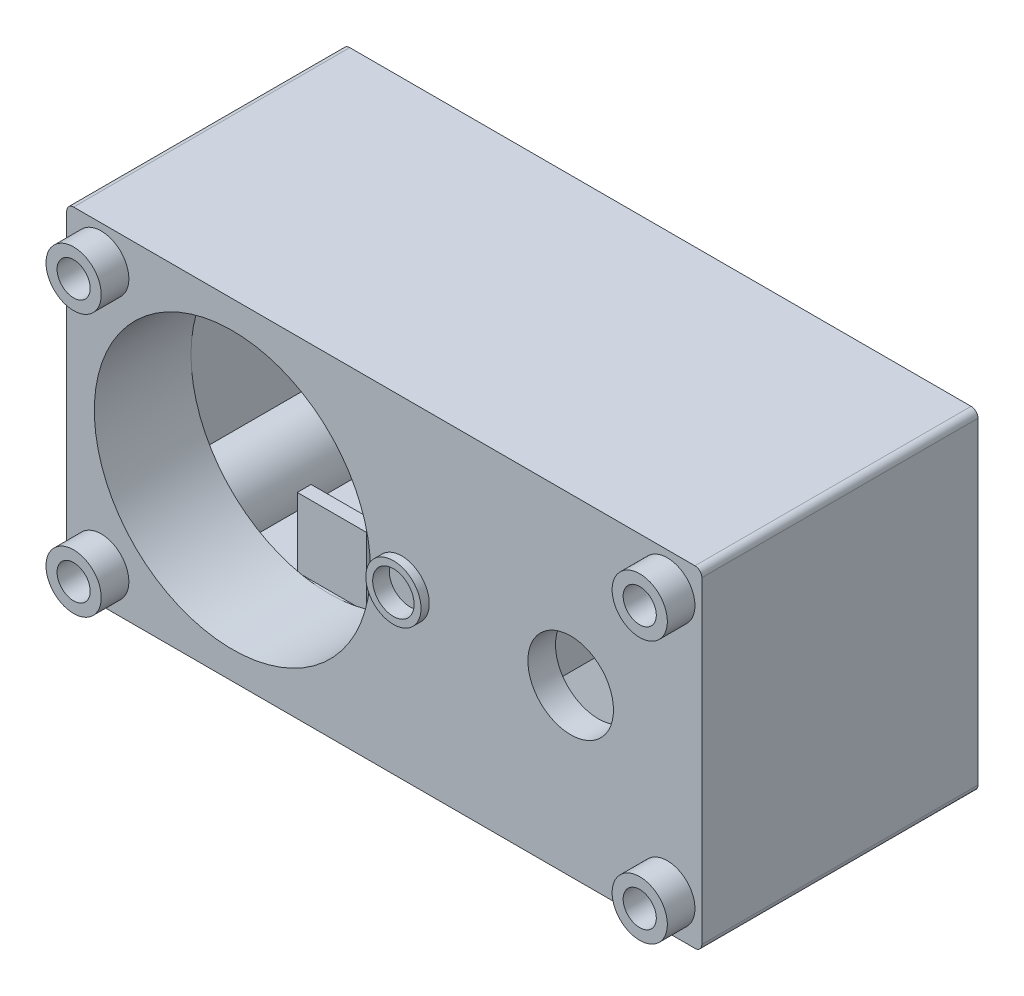
from build123d import *
from build123d.topology import SkipClean

# Parameters (mm, degrees)
SKETCH_1_W          = 23
SKETCH_1_H          = 12
SKETCH_1_R          = 0.6
EXTRUDE_1_DEPTH     = 10
SHELL_2_T           = -1
EXTRUDE_START       = 10
SKETCH_1_3_R        = 1
SKETCH_1_3_R_2      = 0.6
EXTRUDE_1_2_DEPTH   = 1
CUT_EXTRUDE_1_REACH = 18.378
SKETCH_2_R          = 5
SKETCH_2_R_2        = 1.55
SKETCH_2_3_R        = 1
SKETCH_2_3_R_2      = 0.75
EXTRUDE_2_DEPTH     = 0.3
CUT_EXTRUDE_START   = -0.3
SKETCH_2_4_R        = 0.75
CUT_EXTRUDE_2_DEPTH = 0.3
EXTRUDE_3_DEPTH     = 5
SKETCH_4_R          = 5.5
SKETCH_4_R_2        = 5
EXTRUDE_4_DEPTH     = 2.5
EXTRUDE_START_2     = -3.6
SKETCH_5_W          = 2.5
SKETCH_5_H          = 2.5
EXTRUDE_2_2_DEPTH   = 0.5
FILLET_1_R          = 0.25


with BuildPart() as part:
    # 草图1 → Extrude 1 (new body)
    with BuildSketch(Plane.XY):
        Rectangle(SKETCH_1_W, SKETCH_1_H)
        with Locations((-10.25, -4.75)):
            Circle(SKETCH_1_R, mode=Mode.SUBTRACT)
        with Locations((10.25, -4.75)):
            Circle(SKETCH_1_R, mode=Mode.SUBTRACT)
        with Locations((-10.25, 4.75)):
            Circle(SKETCH_1_R, mode=Mode.SUBTRACT)
        with Locations((10.25, 4.75)):
            Circle(SKETCH_1_R, mode=Mode.SUBTRACT)
    extrude(amount=EXTRUDE_1_DEPTH)

    # 抽壳2
    shell_2_openings = [part.faces().sort_by_distance(p)[0] for p in [
        (0, 0, 0),
    ]]
    offset(amount=SHELL_2_T, openings=shell_2_openings)

    # 草图1<3> → Extrude 1 2 (add)
    # profile 1 of 4: a face of its own
    with BuildSketch(Plane.XY.offset(EXTRUDE_START)):
        with Locations((-10.25, 4.75)):
            Circle(SKETCH_1_3_R)
        with Locations((-10.25, 4.75)):
            Circle(SKETCH_1_3_R_2, mode=Mode.SUBTRACT)
    # profile 2 of 4: a face of its own
    with BuildSketch(Plane.XY.offset(EXTRUDE_START)):
        with Locations((-10.25, -4.75)):
            Circle(SKETCH_1_3_R)
        with Locations((-10.25, -4.75)):
            Circle(SKETCH_1_3_R_2, mode=Mode.SUBTRACT)
    # profile 3 of 4: a face of its own
    with BuildSketch(Plane.XY.offset(EXTRUDE_START)):
        with Locations((10.25, -4.75)):
            Circle(SKETCH_1_3_R)
        with Locations((10.25, -4.75)):
            Circle(SKETCH_1_3_R_2, mode=Mode.SUBTRACT)
    # profile 4 of 4: a face of its own
    with BuildSketch(Plane.XY.offset(EXTRUDE_START)):
        with Locations((10.25, 4.75)):
            Circle(SKETCH_1_3_R)
        with Locations((10.25, 4.75)):
            Circle(SKETCH_1_3_R_2, mode=Mode.SUBTRACT)
    extrude(amount=EXTRUDE_1_2_DEPTH)

    # 草图2 → 切除-拉伸1 (cut, up to next)
    with BuildSketch(Plane.XY.offset(10), mode=Mode.PRIVATE) as cut_extrude_1_sk1:
        with Locations((-5.5, 0)):
            Circle(SKETCH_2_R)
    cut_extrude_1_tool1 = extrude(cut_extrude_1_sk1.sketch, amount=-CUT_EXTRUDE_1_REACH, mode=Mode.PRIVATE) & part.part
    # 草图2 → 切除-拉伸1 (cut, up to next)
    with BuildSketch(Plane.XY.offset(10), mode=Mode.PRIVATE) as cut_extrude_1_sk2:
        with Locations((6.75, 0)):
            Circle(SKETCH_2_R_2)
    cut_extrude_1_tool2 = extrude(cut_extrude_1_sk2.sketch, amount=-CUT_EXTRUDE_1_REACH, mode=Mode.PRIVATE) & part.part
    add(cut_extrude_1_tool1.solids().sort_by_distance((-5.5, 0, 10))[0], mode=Mode.SUBTRACT)
    add(cut_extrude_1_tool2.solids().sort_by_distance((6.75, 0, 10))[0], mode=Mode.SUBTRACT)

    # 草图2<3> → Extrude 2 (add)
    with BuildSketch(Plane.XY.offset(10)):
        with Locations((0.63, 0)):
            Circle(SKETCH_2_3_R)
        with Locations((0.63, 0)):
            Circle(SKETCH_2_3_R_2, mode=Mode.SUBTRACT)
    extrude(amount=EXTRUDE_2_DEPTH)

    # 草图2<4> → 切除-拉伸2 (cut)
    with BuildSketch(Plane.XY.offset(10).offset(CUT_EXTRUDE_START)):
        with Locations((0.63, 0)):
            Circle(SKETCH_2_4_R)
    extrude(amount=CUT_EXTRUDE_2_DEPTH, mode=Mode.SUBTRACT)

    # 草图3 → 拉伸-薄壁3 (add)
    with BuildSketch(Plane(origin=(0, 0, 9), x_dir=(-1, 0, 0), z_dir=(0, 0, -1))):
        Polygon((-4.575, 5), (-2.95, 3.375), (-2.95, -3.375), (-4.575, -5), (-4.221446609, -5.353553391), (-2.45, -3.582106781), (-2.45, 3.582106781), (-4.221446609, 5.353553391), align=None)
    extrude(amount=EXTRUDE_3_DEPTH)

    # 草图4 → 拉伸-薄壁4 (add)
    with SkipClean():  # the faces are left unmerged after this step: merging them gives an invalid solid
        with BuildSketch(Plane(origin=(0, 0, 9), x_dir=(-1, 0, 0), z_dir=(0, 0, -1))):
            with Locations((5.5, 0)):
                Circle(SKETCH_4_R)
            with Locations((5.5, 0)):
                Circle(SKETCH_4_R_2, mode=Mode.SUBTRACT)
        extrude(amount=EXTRUDE_4_DEPTH)

    # 草图5 → Extrude 2 2 (add)
    with SkipClean():  # the faces are left unmerged after this step: merging them gives an invalid solid
        with BuildSketch(Plane.XY.offset(10).offset(EXTRUDE_START_2)):
            with Locations((-5.5, 3.75)):
                Rectangle(SKETCH_5_W, SKETCH_5_H)
            with Locations((-5.5, -3.75)):
                Rectangle(SKETCH_5_W, SKETCH_5_H)
        extrude(amount=-EXTRUDE_2_2_DEPTH)

    # 圆角1
    fillet_1_edges = [part.edges().sort_by_distance(p)[0] for p in [
        (11.5, 6, 5),
        (-11.5, 6, 5),
        (-11.5, -6, 5),
        (11.5, -6, 5),
    ]]
    fillet(fillet_1_edges, radius=FILLET_1_R)


solid = part.part
